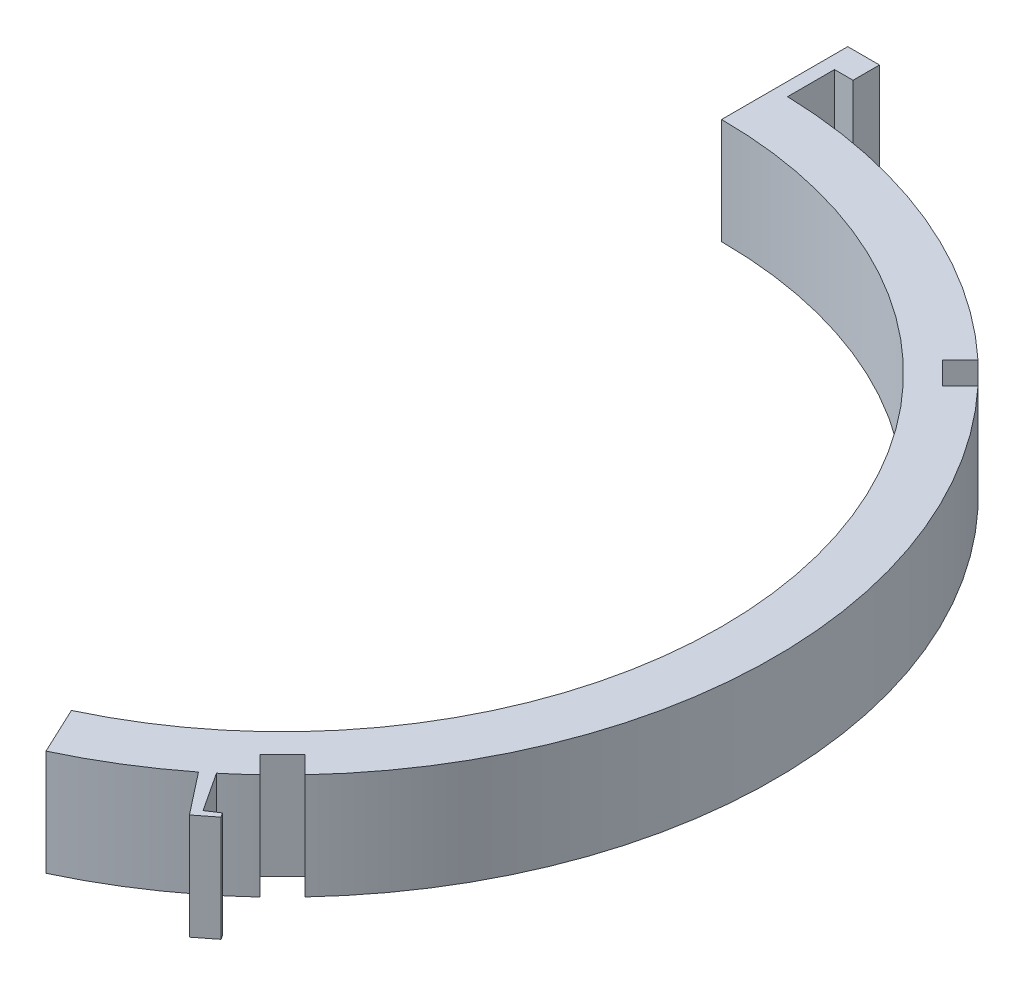
from build123d import *

# Parameters (mm, degrees)
BOSS_EXTRUDE1_DEPTH     = 10
EXTRUDE_THIN1_DEPTH     = 10
CUT_EXTRUDE_THIN2_DEPTH = 10
BOSS_EXTRUDE2_DEPTH     = 10


# Read off the part's stored shape, not the designer's step: Extrude-Thin1
with BuildPart() as part:
    # Sketch1 → Boss-Extrude1 (new body)
    with BuildSketch(Plane(origin=(0, 0, 0), x_dir=(1, 0, 0), z_dir=(0, 1, 0))):
        with BuildLine():
            ThreePointArc((-17.640256265, -37.564229779), (0, 41.5), (17.640256265, -37.564229779))
            Line((17.640256265, -37.564229779), (19.765588345, -42.090040596))
            ThreePointArc((19.765588345, -42.090040596), (24.378319794, -39.597317132), (28.681103985, -36.601151269))
            Line((28.681103985, -36.601151269), (29.481767388, -35.626435952))
            Line((29.481767388, -35.626435952), (29.623728376, -35.842498756))
            ThreePointArc((29.623728376, -35.842498756), (-5.835552757, 46.132378261), (-19.765588345, -42.090040596))
            Line((-19.765588345, -42.090040596), (-17.640256265, -37.564229779))
        make_face()
    extrude(amount=BOSS_EXTRUDE1_DEPTH)

    # Extrude-Thin1 outline → Extrude-Thin1 (add)
    with BuildSketch(Plane(origin=(0, 0, 0), x_dir=(1, 0, 0), z_dir=(0, 1, 0))):
        with BuildLine():
            Line((-3, 50.921232979), (-1.25, 50.921232979))
            Line((-1.25, 50.921232979), (-1.25, 46.483195888))
            ThreePointArc((-1.25, 46.483195888), (0, 46.5), (1.25, 46.483195888))
            Line((1.25, 46.483195888), (1.25, 50.921232979))
            Line((1.25, 50.921232979), (3, 50.921232979))
            Line((3, 50.921232979), (3, 53.421232979))
            Line((3, 53.421232979), (-3, 53.421232979))
            Line((-3, 53.421232979), (-3, 50.921232979))
        make_face()
    extrude(amount=EXTRUDE_THIN1_DEPTH)

    # SurfaceCut1
    split(bisect_by=Plane(origin=(0, 0, 0), x_dir=(0, 0, -1), z_dir=(1, 0, 0)), keep=Keep.TOP)

    # Sketch3 → Cut-Extrude-Thin2 (cut)
    with BuildSketch(Plane(origin=(0, 0, 0), x_dir=(1, 0, 0), z_dir=(0, 1, 0))):
        Polygon((32.254075142, 30.132754798), (35.916621941, 33.795301597), (33.795301597, 35.916621941), (30.132754798, 32.254075142), align=None)
        Polygon((30.132754798, -32.254075142), (33.795301597, -35.916621941), (35.916621941, -33.795301597), (32.254075142, -30.132754798), align=None)
    extrude(amount=CUT_EXTRUDE_THIN2_DEPTH, mode=Mode.SUBTRACT)

    # Sketch1<6> → Boss-Extrude2 (add)
    with BuildSketch(Plane(origin=(0, 0, 0), x_dir=(1, 0, 0), z_dir=(0, 1, 0))):
        with BuildLine():
            Line((32.051958284, -39.538233554), (29.623728376, -35.842498756))
            ThreePointArc((29.623728376, -35.842498756), (29.15488394, -36.2248912), (28.681103985, -36.601151269))
            Line((28.681103985, -36.601151269), (31.765093661, -40.536758932))
            Line((31.765093661, -40.536758932), (33.437562335, -39.226192289))
            Line((33.437562335, -39.226192289), (33.162966722, -38.808261285))
            Line((33.162966722, -38.808261285), (32.051958284, -39.538233554))
        make_face()
        with BuildLine():
            ThreePointArc((28.681103985, -36.601151269), (29.15488394, -36.2248912), (29.623728376, -35.842498756))
            Line((29.623728376, -35.842498756), (29.481767388, -35.626435952))
            Line((29.481767388, -35.626435952), (28.681103985, -36.601151269))
        make_face()
    extrude(amount=BOSS_EXTRUDE2_DEPTH)


solid = part.part
